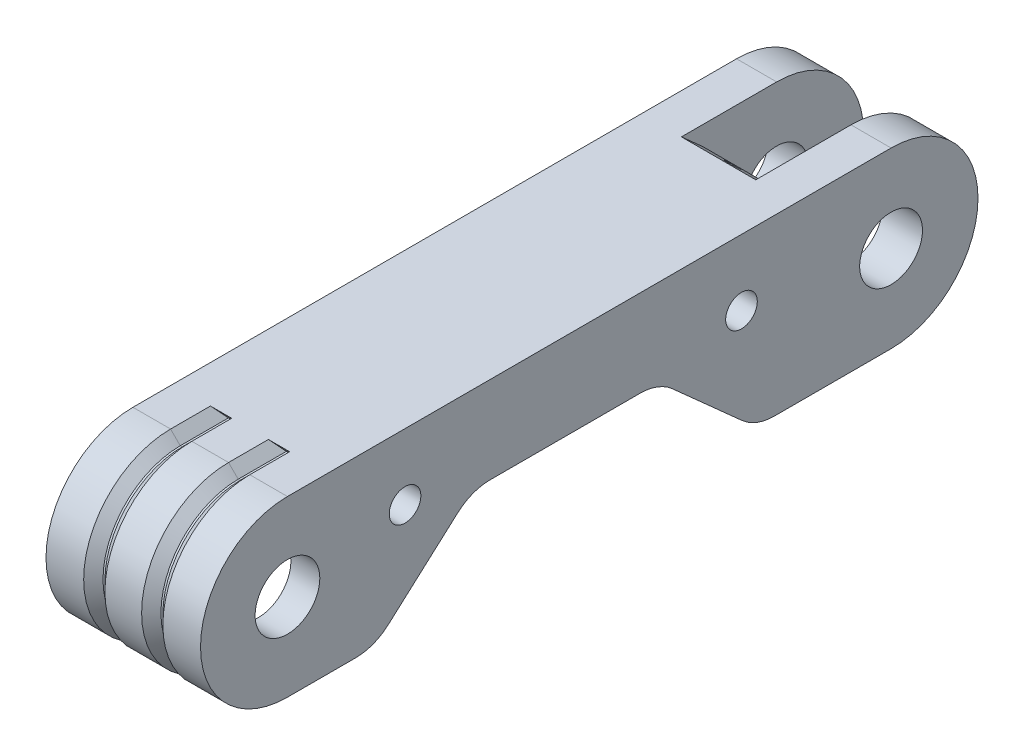
from build123d import *

# Parameters (mm, degrees)
SKETCH1_R                              = 3.35
SKETCH1_R_2                            = 3.25
FINGER_FRAME_DEPTH                     = 8
ROUTING_FEATURE_DEPTH                  = 3.85
SKETCH3_R                              = 1.6375
ROUTING_PINS_DEPTH                     = 74.819035485
FINGER_PAD_OUTLINE_DEPTH               = 16
FINGER_OUTLINE_DEPTH                   = 75.236463413
BACK_CUTAWAY_DEPTH                     = 5
TENDON_TRACK_DEPTH                     = 0.1
TENDON_TRACK_CHAMFER_SIZE              = 1
SKETCH19_R                             = 1.85
DISTAL_SPRING_ANCHOR_DEPTH             = 4.5
FINGER_CONTOURING_R                    = 5
CONTOURING_R                           = 1
LPATTERN5_COUNT                        = 2
LPATTERN5_PITCH                        = 6
TENDON_TRACK_CHAMFER_OF_LPATTERN5_SIZE = 1
SKETCH34_R                             = 1.85
CUT_EXTRUDE2_DEPTH                     = 3.7
SKETCH37_R                             = 0.75
CUT_EXTRUDE3_DEPTH                     = 17


# Some blends are built 0.0001 mm under size
with BuildPart() as part:
    # Sketch1 → Finger Frame (new, symmetric)
    with BuildSketch(Plane(origin=(0, 0, 0), x_dir=(0, 0, -1), z_dir=(1, 0, 0))):
        with BuildLine():
            Line((0, 9), (62.5, 9))
            ThreePointArc((62.5, 9), (71.5, 0), (62.5, -9))
            Line((62.5, -9), (0, -9))
            ThreePointArc((0, -9), (-9, 0), (0, 9))
        make_face()
        Circle(SKETCH1_R, mode=Mode.SUBTRACT)
        with Locations((62.5, 0)):
            Circle(SKETCH1_R_2, mode=Mode.SUBTRACT)
    extrude(amount=FINGER_FRAME_DEPTH, both=True)

    # Sketch2 → Routing Feature (cut, symmetric)
    with BuildSketch(Plane(origin=(0, 0, 0), x_dir=(0, 0, -1), z_dir=(1, 0, 0))):
        with BuildLine():
            Line((52.640248552, 9), (55.621672522, 6.333333333))
            ThreePointArc((55.621672522, 6.333333333), (53.151986473, -0.192725473), (55.888551596, -6.611448404))
            Line((55.888551596, -6.611448404), (53.15, -9.35))
            Line((53.15, -9.35), (62.5, -9.35))
            ThreePointArc((62.5, -9.35), (71.85, 0), (62.5, 9.35))
            Line((62.5, 9.35), (52.640248552, 9.35))
            Line((52.640248552, 9.35), (52.640248552, 9))
        make_face()
    extrude(amount=ROUTING_FEATURE_DEPTH, both=True, mode=Mode.SUBTRACT)

    # Sketch3 → Routing Pins (cut, through all)
    with BuildSketch(Plane(origin=(8, 0, 0), x_dir=(0, 0, -1), z_dir=(1, 0, 0))):
        with Locations((47.010947419, 2.1625)):
            Circle(SKETCH3_R)
        with Locations((12.175, 2.1625)):
            Circle(SKETCH3_R)
    extrude(amount=-ROUTING_PINS_DEPTH, mode=Mode.SUBTRACT)

    # Sketch6 → Finger Pad Outline (add)
    with BuildSketch(Plane(origin=(8, 0, 0), x_dir=(0, 0, -1), z_dir=(1, 0, 0))):
        with BuildLine():
            Line((11.95, 11.95), (47.390248552, 11.95))
            ThreePointArc((47.390248552, 11.95), (49.476213557, 11.085965005), (50.340248552, 9))
            Line((50.340248552, 9), (9, 9))
            ThreePointArc((9, 9), (9.864034995, 11.085965005), (11.95, 11.95))
        make_face()
    extrude(amount=-FINGER_PAD_OUTLINE_DEPTH)

    # Sketch5 → Finger Outline (cut, through all)
    with BuildSketch(Plane(origin=(8, 0, 0), x_dir=(0, 0, -1), z_dir=(1, 0, 0))):
        Polygon((9, -9), (19.062305899, 0), (38.437694101, 0), (48.5, -9), align=None)
    extrude(amount=-FINGER_OUTLINE_DEPTH, mode=Mode.SUBTRACT)

    # Sketch10 → Back Cutaway (cut, symmetric)
    with BuildSketch(Plane(origin=(0, 0, 0), x_dir=(0, 0, -1), z_dir=(1, 0, 0))):
        with BuildLine():
            Line((0, -5), (0, -9))
            Line((0, -9), (44.690720781, -9))
            Line((44.690720781, -9), (48.549694086, 1.602442015))
            ThreePointArc((48.549694086, 1.602442015), (48.352308892, 3.101731415), (47.010947419, 3.8))
            Line((47.010947419, 3.8), (12.175, 3.8))
            Line((12.175, 3.8), (0.50065622, 4.974871189))
            ThreePointArc((0.50065622, 4.974871189), (-4.993713846, 0.250643227), (0, -5))
        make_face()
    extrude(amount=BACK_CUTAWAY_DEPTH, both=True, mode=Mode.SUBTRACT)

    # Sketch11 → Tendon Track (cut, symmetric)
    with BuildSketch(Plane(origin=(-3, 0, 0), x_dir=(0, 0, -1), z_dir=(1, 0, 0))):
        with BuildLine():
            Line((0, 9), (4.127477574, 9))
            Line((4.127477574, 9), (4.988427523, 8))
            Line((4.988427523, 8), (0, 8))
            ThreePointArc((0, 8), (-8, 0), (0, -8))
            Line((0, -8), (0, -9))
            ThreePointArc((0, -9), (-9, 0), (0, 9))
        make_face()
    tendon_track = extrude(amount=TENDON_TRACK_DEPTH, both=True, mode=Mode.SUBTRACT)

    # Tendon Track Chamfer
    tendon_track_chamfer_edges = [part.edges().sort_by_distance(p)[0] for p in [
        (-3.1, 0, 9),
        (-3.1, 9, -2.063738787),
        (-2.9, 0, 9),
        (-2.9, 9, -2.063738787),
    ]]
    chamfer(tendon_track_chamfer_edges, length=TENDON_TRACK_CHAMFER_SIZE - 0.0001)  # a hair under: the kernel refuses the full size

    # Sketch19 → Distal Spring Anchor (cut)
    with BuildSketch(Plane.XZ.offset(9)):
        with Locations(Location((0, -51, 0), (0, 0, 270))):
            Circle(SKETCH19_R)
    extrude(amount=-DISTAL_SPRING_ANCHOR_DEPTH, mode=Mode.SUBTRACT)

    # Finger Contouring
    # the kernel refuses this fillet: 5 mm, written as the material it adds along each edge
    with BuildSketch(Plane(origin=(-5, 0, -19.062305899), x_dir=(0, -0.6666666666666643, 0.7453559924999321), z_dir=(-1, 0, 0)), Plane(origin=(-5, 0, -38.437694101), x_dir=(0, 0, 1), z_dir=(-1, 0, 0)), Plane(origin=(8, 0, -19.062305899), x_dir=(0, -0.6666666666666643, 0.7453559924999321), z_dir=(-1, 0, 0))) as finger_contouring_piece_1:
        with BuildLine():
            CenterArc((FINGER_CONTOURING_R * 0.38196601125, -FINGER_CONTOURING_R), FINGER_CONTOURING_R, 90, 41.810314896)
            Line((-FINGER_CONTOURING_R * 0.284700655417, -FINGER_CONTOURING_R * 0.2546440075), (0, 0))
            Line((0, 0), (FINGER_CONTOURING_R * 0.38196601125, 0))
        make_face()
    extrude(amount=3)
    with BuildSketch(Plane(origin=(8, 0, -38.437694101), x_dir=(0, -0.6666666666666639, -0.7453559924999323), z_dir=(-1, 0, 0))) as finger_contouring_piece_2:
        with BuildLine():
            CenterArc((FINGER_CONTOURING_R * 0.38196601125, FINGER_CONTOURING_R), FINGER_CONTOURING_R, 228.189685104, 41.810314896)
            Line((-FINGER_CONTOURING_R * 0.284700655417, FINGER_CONTOURING_R * 0.2546440075), (0, 0))
            Line((0, 0), (FINGER_CONTOURING_R * 0.38196601125, 0))
        make_face()
    extrude(amount=3)
    # the kernel refuses this fillet: 5 mm, written as the material it takes off along each edge
    with BuildSketch(Plane(origin=(12.774575141, -9, -48.5), x_dir=(0, 0.6666666666666652, 0.7453559924999312), z_dir=(-1, 0, 0))) as finger_contouring_2_piece_1:
        with BuildLine():
            CenterArc((FINGER_CONTOURING_R * 0.38196601125, FINGER_CONTOURING_R), FINGER_CONTOURING_R, 228.189685104, 41.810314896)
            Line((-FINGER_CONTOURING_R * 0.284700655417, FINGER_CONTOURING_R * 0.2546440075), (0, 0))
            Line((0, 0), (FINGER_CONTOURING_R * 0.38196601125, 0))
        make_face()
    extrude(amount=25.549150281, mode=Mode.SUBTRACT)
    with BuildSketch(Plane(origin=(-0.225424859, -9, -9), x_dir=(0, 0, 1), z_dir=(-1, 0, 0)), Plane(origin=(12.774575141, -9, -9), x_dir=(0, 0, 1), z_dir=(-1, 0, 0))) as finger_contouring_2_piece_2:
        with BuildLine():
            CenterArc((FINGER_CONTOURING_R * 0.38196601125, FINGER_CONTOURING_R), FINGER_CONTOURING_R, 228.189685104, 41.810314896)
            Line((-FINGER_CONTOURING_R * 0.284700655417, FINGER_CONTOURING_R * 0.2546440075), (0, 0))
            Line((0, 0), (FINGER_CONTOURING_R * 0.38196601125, 0))
        make_face()
    extrude(amount=12.549150281, mode=Mode.SUBTRACT)

    # Contouring
    contouring_edges = [part.edges().sort_by_distance(p)[0] for p in [
        (0, -6.611448404, -55.888551596),
        (0, 6.333333333, -55.621672522),
    ]]
    fillet(contouring_edges, radius=CONTOURING_R)

    # SurfaceCut3
    split(bisect_by=Plane(origin=(0, 9, 0), x_dir=(1, 0, 0), z_dir=(0, 1, 0)), keep=Keep.BOTTOM)

    # LPattern5: Tendon Track ×2
    with Locations(*[(i * LPATTERN5_PITCH, 0, 0) for i in range(1, LPATTERN5_COUNT)]):
        add(tendon_track, mode=Mode.SUBTRACT)

    # Tendon Track Chamfer of LPattern5
    tendon_track_chamfer_of_lpattern5_edges = [part.edges().sort_by_distance(p)[0] for p in [
        (2.9, 0, 9),
        (2.9, 9, -2.063738787),
        (3.1, 0, 9),
        (3.1, 9, -2.063738787),
    ]]
    chamfer(tendon_track_chamfer_of_lpattern5_edges, length=TENDON_TRACK_CHAMFER_OF_LPATTERN5_SIZE - 0.0001)  # a hair under: the kernel refuses the full size

    # Sketch34 → Cut-Extrude2 (cut)
    with BuildSketch(Plane.XZ.offset(-3.8)):
        with Locations(Location((0, -28.75, 0), (0, 0, 270))):
            Circle(SKETCH34_R)
    extrude(amount=-CUT_EXTRUDE2_DEPTH, mode=Mode.SUBTRACT)

    # Sketch37 → Cut-Extrude3 (cut)
    with BuildSketch(Plane(origin=(0, 31.157149803, -27.867801978), x_dir=(1, 0, 0), z_dir=(0, 0.7453559924999322, -0.6666666666666642))):
        with Locations(Location((0, 35.235724705, 0), (0, 0, 270))):
            Circle(SKETCH37_R)
    extrude(amount=-CUT_EXTRUDE3_DEPTH, mode=Mode.SUBTRACT)


solid = part.part
